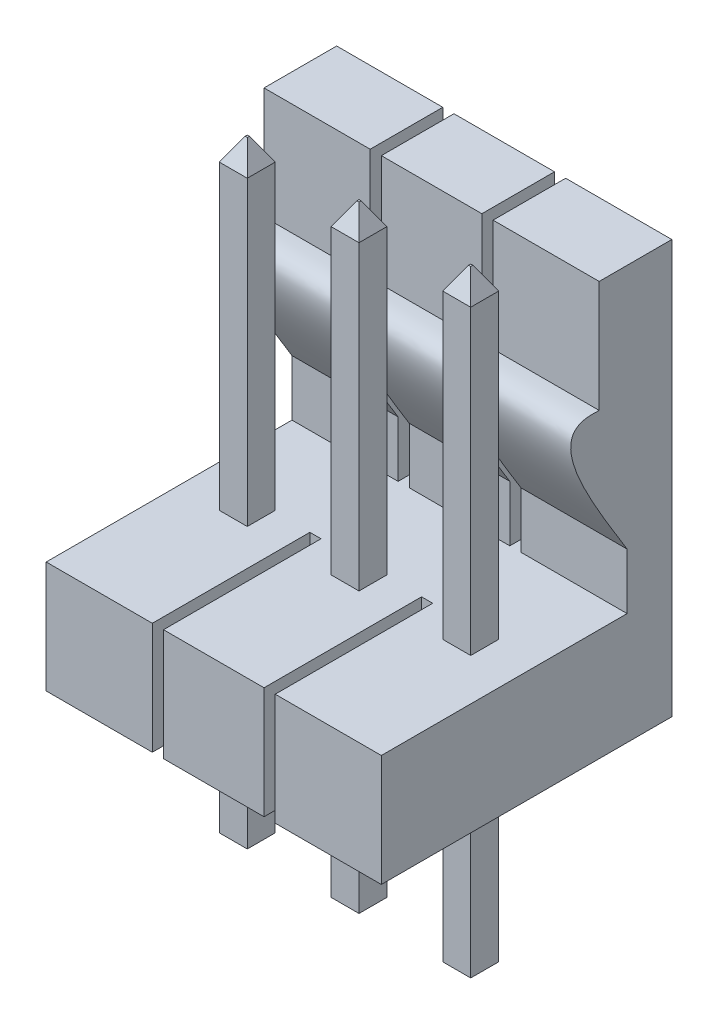
from build123d import *
from OCP.BRepFilletAPI import BRepFilletAPI_MakeChamfer

# Parameters (mm, degrees)
BASE_EXTRUDE_DEPTH          = 3.302
BASE_EXTRUDE_DEPTH_BACK     = 3.302
SKETCH3_W                   = 7.62
SKETCH3_H                   = 9.398
CUT_EXTRUDE1_START          = -7.62
CUT_EXTRUDE1_DEPTH          = 7.62
SKETCH5_W                   = 3.5814
SKETCH5_H                   = 2.54
CUT_EXTRUDE2_DEPTH          = 0.127
BOSS_EXTRUDE1_START         = -9.906
SKETCH6_W                   = 0.635
SKETCH6_H                   = 0.635
BOSS_EXTRUDE1_DEPTH         = 13.716
CHAMFER1_SIZE               = 0.508
CHAMFER1_SIZE2              = 0.293293937
LPATTERN2_COUNT             = 3
LPATTERN2_PITCH             = 2.54
CHAMFER1_OF_LPATTERN2_SIZE  = 0.508
CHAMFER1_OF_LPATTERN2_SIZE2 = 0.293293937
LPATTERN3_COUNT             = 2
LPATTERN3_PITCH             = 2.54


# Read off the part's stored shape, not the designer's step: Cut-Extrude1
with BuildPart() as part:
    # Sketch3 → Base-Extrude (new, two sides: drawn at the far end of the back side and taken through both)
    with BuildSketch(Plane.XY.offset(-BASE_EXTRUDE_DEPTH_BACK)):
        with Locations((2.54, 4.699)):
            Rectangle(SKETCH3_W, SKETCH3_H)
    extrude(amount=BASE_EXTRUDE_DEPTH + BASE_EXTRUDE_DEPTH_BACK)

    # Cut-Extrude1 outline → Cut-Extrude1 (cut)
    with BuildSketch(Plane.ZY.offset(1.27).offset(CUT_EXTRUDE1_START)):
        with BuildLine():
            add(Edge.make_bspline(
                [(-2.286, 3.81), (-1.368133743, 5.298530644), (-0.381370103, 6.898794196), (-1.568138006, 6.86066242), (-1.651, 6.858)],
                knots=[0, 0, 0, 0, 0.930178433, 1, 1, 1, 1], degree=3))
            Line((-2.286, 3.81), (-2.286, 2.54))
            Line((-2.286, 2.54), (3.302, 2.54))
            Line((3.302, 2.54), (3.302, 9.398))
            Line((3.302, 9.398), (-1.651, 9.398))
            Line((-1.651, 9.398), (-1.651, 6.858))
        make_face()
    extrude(amount=CUT_EXTRUDE1_DEPTH, mode=Mode.SUBTRACT)

    # Sketch5 → Cut-Extrude2 (cut, symmetric)
    with BuildSketch(Plane(origin=(1.27, 0, 0), x_dir=(0, 0, -1), z_dir=(1, 0, 0))):
        with Locations((-1.5113, 1.27)):
            Rectangle(SKETCH5_W, SKETCH5_H)
        with BuildLine():
            Line((3.302, 2.54), (3.302, 9.398))
            Line((3.302, 9.398), (1.651, 9.398))
            Line((1.651, 9.398), (1.651, 6.858))
            add(Edge.make_bspline(
                [(2.286, 3.81), (1.368133743, 5.298530644), (0.381370103, 6.898794196), (1.568138006, 6.86066242), (1.651, 6.858)],
                knots=[0, 0, 0, 0, 0.930178433, 1, 1, 1, 1], degree=3))
            Line((2.286, 3.81), (2.286, 2.54))
            Line((2.286, 2.54), (3.302, 2.54))
        make_face()
    cut_extrude2 = extrude(amount=CUT_EXTRUDE2_DEPTH, both=True, mode=Mode.SUBTRACT)

    # Sketch6 → Boss-Extrude1 (add)
    with BuildSketch(Plane.XZ.offset(BOSS_EXTRUDE1_START)):
        Rectangle(SKETCH6_W, SKETCH6_H)
    boss_extrude1 = extrude(amount=BOSS_EXTRUDE1_DEPTH)

    # Chamfer1: one chamfer whose edges measure the first distance from different faces: ONE call of the kernel's chamfer builder (chamfer() names one face for all edges)
    chamfer1_edges_1 = [part.edges().sort_by_distance(p)[0] for p in [
        (-0.3175, 9.906, 0),
    ]]
    chamfer1_side_1 = [part.faces().sort_by_distance(p)[0] for p in [
        (-0.3175, 6.223, 0),
    ]]
    chamfer1_edges_2 = [part.edges().sort_by_distance(p)[0] for p in [
        (0, 9.906, -0.3175),
    ]]
    chamfer1_side_2 = [part.faces().sort_by_distance(p)[0] for p in [
        (0, 6.223, -0.3175),
    ]]
    chamfer1_edges_3 = [part.edges().sort_by_distance(p)[0] for p in [
        (0.3175, 9.906, 0),
    ]]
    chamfer1_side_3 = [part.faces().sort_by_distance(p)[0] for p in [
        (0.3175, 6.223, 0),
    ]]
    chamfer1_edges_4 = [part.edges().sort_by_distance(p)[0] for p in [
        (0, 9.906, 0.3175),
    ]]
    chamfer1_side_4 = [part.faces().sort_by_distance(p)[0] for p in [
        (0, 6.223, 0.3175),
    ]]
    chamfer1 = BRepFilletAPI_MakeChamfer(part.part.solid().wrapped)
    for e in chamfer1_edges_1:
        chamfer1.Add(CHAMFER1_SIZE, CHAMFER1_SIZE2, e.wrapped, chamfer1_side_1[0].wrapped)  # the first distance lies on this face
    for e in chamfer1_edges_2:
        chamfer1.Add(CHAMFER1_SIZE, CHAMFER1_SIZE2, e.wrapped, chamfer1_side_2[0].wrapped)  # the first distance lies on this face
    for e in chamfer1_edges_3:
        chamfer1.Add(CHAMFER1_SIZE, CHAMFER1_SIZE2, e.wrapped, chamfer1_side_3[0].wrapped)  # the first distance lies on this face
    for e in chamfer1_edges_4:
        chamfer1.Add(CHAMFER1_SIZE, CHAMFER1_SIZE2, e.wrapped, chamfer1_side_4[0].wrapped)  # the first distance lies on this face
    add(Compound.cast(chamfer1.Shape()), mode=Mode.REPLACE)

    # LPattern2: Boss-Extrude1 ×3
    with Locations(*[(i * LPATTERN2_PITCH, 0, 0) for i in range(1, LPATTERN2_COUNT)]):
        add(boss_extrude1)

    # Chamfer1 of LPattern2: one chamfer whose edges measure the first distance from different faces: ONE call of the kernel's chamfer builder (chamfer() names one face for all edges)
    chamfer1_of_lpattern2_edges_1 = [part.edges().sort_by_distance(p)[0] for p in [
        (2.2225, 9.906, 0),
    ]]
    chamfer1_of_lpattern2_side_1 = [part.faces().sort_by_distance(p)[0] for p in [
        (2.2225, 6.223, 0),
    ]]
    chamfer1_of_lpattern2_edges_2 = [part.edges().sort_by_distance(p)[0] for p in [
        (2.54, 9.906, -0.3175),
    ]]
    chamfer1_of_lpattern2_side_2 = [part.faces().sort_by_distance(p)[0] for p in [
        (2.54, 6.223, -0.3175),
    ]]
    chamfer1_of_lpattern2_edges_3 = [part.edges().sort_by_distance(p)[0] for p in [
        (2.8575, 9.906, 0),
    ]]
    chamfer1_of_lpattern2_side_3 = [part.faces().sort_by_distance(p)[0] for p in [
        (2.8575, 6.223, 0),
    ]]
    chamfer1_of_lpattern2_edges_4 = [part.edges().sort_by_distance(p)[0] for p in [
        (2.54, 9.906, 0.3175),
    ]]
    chamfer1_of_lpattern2_side_4 = [part.faces().sort_by_distance(p)[0] for p in [
        (2.54, 6.223, 0.3175),
    ]]
    chamfer1_of_lpattern2_edges_5 = [part.edges().sort_by_distance(p)[0] for p in [
        (4.7625, 9.906, 0),
    ]]
    chamfer1_of_lpattern2_side_5 = [part.faces().sort_by_distance(p)[0] for p in [
        (4.7625, 6.223, 0),
    ]]
    chamfer1_of_lpattern2_edges_6 = [part.edges().sort_by_distance(p)[0] for p in [
        (5.08, 9.906, -0.3175),
    ]]
    chamfer1_of_lpattern2_side_6 = [part.faces().sort_by_distance(p)[0] for p in [
        (5.08, 6.223, -0.3175),
    ]]
    chamfer1_of_lpattern2_edges_7 = [part.edges().sort_by_distance(p)[0] for p in [
        (5.3975, 9.906, 0),
    ]]
    chamfer1_of_lpattern2_side_7 = [part.faces().sort_by_distance(p)[0] for p in [
        (5.3975, 6.223, 0),
    ]]
    chamfer1_of_lpattern2_edges_8 = [part.edges().sort_by_distance(p)[0] for p in [
        (5.08, 9.906, 0.3175),
    ]]
    chamfer1_of_lpattern2_side_8 = [part.faces().sort_by_distance(p)[0] for p in [
        (5.08, 6.223, 0.3175),
    ]]
    chamfer1_of_lpattern2 = BRepFilletAPI_MakeChamfer(part.part.solid().wrapped)
    for e in chamfer1_of_lpattern2_edges_1:
        chamfer1_of_lpattern2.Add(CHAMFER1_OF_LPATTERN2_SIZE, CHAMFER1_OF_LPATTERN2_SIZE2, e.wrapped, chamfer1_of_lpattern2_side_1[0].wrapped)  # the first distance lies on this face
    for e in chamfer1_of_lpattern2_edges_2:
        chamfer1_of_lpattern2.Add(CHAMFER1_OF_LPATTERN2_SIZE, CHAMFER1_OF_LPATTERN2_SIZE2, e.wrapped, chamfer1_of_lpattern2_side_2[0].wrapped)  # the first distance lies on this face
    for e in chamfer1_of_lpattern2_edges_3:
        chamfer1_of_lpattern2.Add(CHAMFER1_OF_LPATTERN2_SIZE, CHAMFER1_OF_LPATTERN2_SIZE2, e.wrapped, chamfer1_of_lpattern2_side_3[0].wrapped)  # the first distance lies on this face
    for e in chamfer1_of_lpattern2_edges_4:
        chamfer1_of_lpattern2.Add(CHAMFER1_OF_LPATTERN2_SIZE, CHAMFER1_OF_LPATTERN2_SIZE2, e.wrapped, chamfer1_of_lpattern2_side_4[0].wrapped)  # the first distance lies on this face
    for e in chamfer1_of_lpattern2_edges_5:
        chamfer1_of_lpattern2.Add(CHAMFER1_OF_LPATTERN2_SIZE, CHAMFER1_OF_LPATTERN2_SIZE2, e.wrapped, chamfer1_of_lpattern2_side_5[0].wrapped)  # the first distance lies on this face
    for e in chamfer1_of_lpattern2_edges_6:
        chamfer1_of_lpattern2.Add(CHAMFER1_OF_LPATTERN2_SIZE, CHAMFER1_OF_LPATTERN2_SIZE2, e.wrapped, chamfer1_of_lpattern2_side_6[0].wrapped)  # the first distance lies on this face
    for e in chamfer1_of_lpattern2_edges_7:
        chamfer1_of_lpattern2.Add(CHAMFER1_OF_LPATTERN2_SIZE, CHAMFER1_OF_LPATTERN2_SIZE2, e.wrapped, chamfer1_of_lpattern2_side_7[0].wrapped)  # the first distance lies on this face
    for e in chamfer1_of_lpattern2_edges_8:
        chamfer1_of_lpattern2.Add(CHAMFER1_OF_LPATTERN2_SIZE, CHAMFER1_OF_LPATTERN2_SIZE2, e.wrapped, chamfer1_of_lpattern2_side_8[0].wrapped)  # the first distance lies on this face
    add(Compound.cast(chamfer1_of_lpattern2.Shape()), mode=Mode.REPLACE)

    # LPattern3: Cut-Extrude2 ×2
    with Locations(*[(i * LPATTERN3_PITCH, 0, 0) for i in range(1, LPATTERN3_COUNT)]):
        add(cut_extrude2, mode=Mode.SUBTRACT)


solid = part.part
